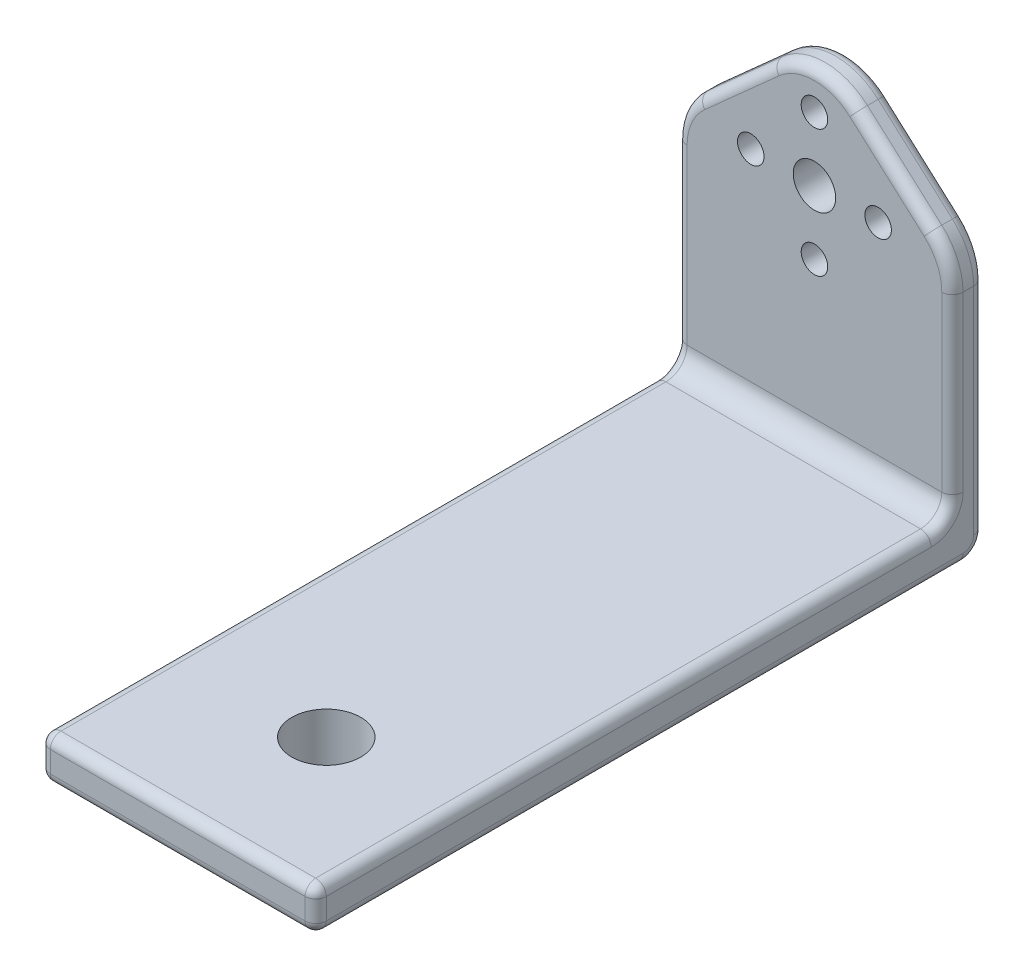
from build123d import *

# Parameters (mm, degrees)
SKETCH1_R           = 2
SKETCH1_R_2         = 1.25
BOSS_EXTRUDE1_DEPTH = 3
SKETCH2_W           = 26
SKETCH2_H           = 4
BOSS_EXTRUDE2_DEPTH = 60
SKETCH3_R           = 3.25
CUT_EXTRUDE1_DEPTH  = 72.226350639
SKETCH4_R           = 8
SKETCH4_R_2         = 3.25
BOSS_EXTRUDE3_DEPTH = 1
SKETCH5_R           = 1.5
BOSS_EXTRUDE4_DEPTH = 3
FILLET1_R           = 2
FILLET2_R           = 1
FILLET3_R           = 0.5


with BuildPart() as part:
    # Sketch1 → Boss-Extrude1 (new body)
    with BuildSketch(Plane.XY):
        with BuildLine():
            Line((-13, -2.68256679), (-13, -25))
            Line((-13, -25), (13, -25))
            Line((13, -25), (13, -2.68256679))
            ThreePointArc((13, -2.68256679), (12.477468733, -0.233620837), (11.000887907, 1.788774838))
            Line((11.000887907, 1.788774838), (4.000887907, 8.052267471))
            ThreePointArc((4.000887907, 8.052267471), (0, 9.580925842), (-4.000887907, 8.052267471))
            Line((-4.000887907, 8.052267471), (-11.000887907, 1.788774838))
            ThreePointArc((-11.000887907, 1.788774838), (-12.477468733, -0.233620837), (-13, -2.68256679))
        make_face()
        Circle(SKETCH1_R, mode=Mode.SUBTRACT)
        with Locations((-6, 0)):
            Circle(SKETCH1_R_2, mode=Mode.SUBTRACT)
        with Locations((0, 6)):
            Circle(SKETCH1_R_2, mode=Mode.SUBTRACT)
        with Locations((6, 0)):
            Circle(SKETCH1_R_2, mode=Mode.SUBTRACT)
        with Locations((0, -6)):
            Circle(SKETCH1_R_2, mode=Mode.SUBTRACT)
    extrude(amount=BOSS_EXTRUDE1_DEPTH)

    # Sketch2 → Boss-Extrude2 (add)
    with BuildSketch(Plane.XY.offset(3)):
        with Locations((0, -23)):
            Rectangle(SKETCH2_W, SKETCH2_H)
    extrude(amount=BOSS_EXTRUDE2_DEPTH)

    # Sketch3 → Cut-Extrude1 (cut, through all)
    with BuildSketch(Plane(origin=(0, -21, 0), x_dir=(1, 0, 0), z_dir=(0, 1, 0))):
        with Locations((1, -50)):
            Circle(SKETCH3_R)
    extrude(amount=-CUT_EXTRUDE1_DEPTH, mode=Mode.SUBTRACT)

    # Sketch4 → Boss-Extrude3 (add)
    with BuildSketch(Plane.XZ.offset(25)):
        with Locations((1, 50)):
            Circle(SKETCH4_R)
        with Locations((1, 50)):
            Circle(SKETCH4_R_2, mode=Mode.SUBTRACT)
    extrude(amount=BOSS_EXTRUDE3_DEPTH)

    # Sketch5 → Boss-Extrude4 (add)
    with BuildSketch(Plane.XZ.offset(25)):
        with Locations((-7.5, 10)):
            Circle(SKETCH5_R)
        with Locations((7.5, 10)):
            Circle(SKETCH5_R)
    extrude(amount=BOSS_EXTRUDE4_DEPTH)

    # Fillet1
    fillet1_edges = [part.edges().sort_by_distance(p)[0] for p in [
        (0, -21, 3),
        (0, -25, 0),
    ]]
    fillet(fillet1_edges, radius=FILLET1_R)

    # Fillet2
    fillet2_edges = [part.edges().sort_by_distance(p)[0] for p in [
        (13, -21, 34),
        (13, -20.414213562, 3.585786438),
        (13, -10.841283395, 3),
        (12.477468733, -0.233620837, 3),
        (7.500887907, 4.920521155, 3),
        (0, 9.580925842, 3),
        (-7.500887907, 4.920521155, 3),
        (-12.477468733, -0.233620837, 3),
        (13, -25, 32.5),
        (13, -24.414213562, 0.585786438),
        (13, -12.841283395, 0),
        (12.477468733, -0.233620837, 0),
        (7.500887907, 4.920521155, 0),
        (0, 9.580925842, 0),
        (-7.500887907, 4.920521155, 0),
        (-12.477468733, -0.233620837, 0),
        (-13, -10.841283395, 3),
        (-13, -20.414213562, 3.585786438),
        (-13, -21, 34),
        (-13, -23, 63),
        (-13, -25, 32.5),
        (-13, -24.414213562, 0.585786438),
        (-13, -12.841283395, 0),
        (0, -21, 63),
        (13, -23, 63),
        (0, -25, 63),
    ]]
    fillet(fillet2_edges, radius=FILLET2_R)

    # Fillet3
    fillet3_edges = [part.edges().sort_by_distance(p)[0] for p in [
        (6, -28, 10),
        (-9, -28, 10),
    ]]
    fillet(fillet3_edges, radius=FILLET3_R)


solid = part.part
